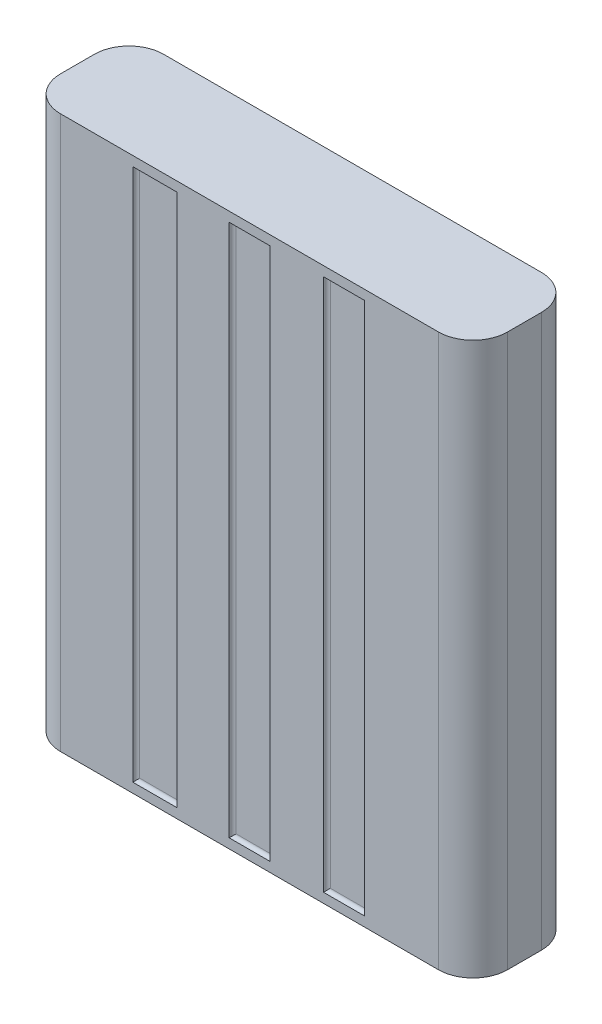
from build123d import *

# Parameters (mm, degrees)
SKETCH1_W           = 12.950156288
SKETCH1_H           = 2.985631362
BOSS_EXTRUDE1_DEPTH = 16
FILLET1_R           = 1
SKETCH2_W           = 10.950156288
SKETCH2_H           = 0.272417851
BOSS_EXTRUDE2_DEPTH = 0.1
FILLET2_R           = 0.1
CUT_EXTRUDE2_DEPTH  = 0.1
SKETCH6_W           = 1.186627285
SKETCH6_H           = 15.441785482
SKETCH6_W_2         = 1.175471446
SKETCH6_W_3         = 1.281551352
CUT_EXTRUDE3_DEPTH  = 0.1
SKETCH10_W          = 1.186627285
SKETCH10_H          = 15.441785482
SKETCH10_W_2        = 1.175471446
SKETCH10_W_3        = 1.281551352
CUT_EXTRUDE4_DEPTH  = 0.1
FILLET6_R           = 0.1
FILLET7_R           = 0.1


with BuildPart() as part:
    # Sketch1 → Boss-Extrude1 (new body)
    with BuildSketch(Plane(origin=(0, 0, 0), x_dir=(1, 0, 0), z_dir=(0, 1, 0))):
        Rectangle(SKETCH1_W, SKETCH1_H)
    extrude(amount=BOSS_EXTRUDE1_DEPTH)

    # Fillet1
    fillet1_edges = [part.edges().sort_by_distance(p)[0] for p in [
        (6.475078144, 8, 1.492815681),
        (-6.475078144, 8, 1.492815681),
        (-6.475078144, 8, -1.492815681),
        (6.475078144, 8, -1.492815681),
    ]]
    fillet(fillet1_edges, radius=FILLET1_R)

    # Sketch2 → Boss-Extrude2 (add)
    with BuildSketch(Plane(origin=(0, 0, -1.492815681), x_dir=(-1, 0, 0), z_dir=(0, 0, -1))):
        with Locations((0, 10.703223293)):
            Rectangle(SKETCH2_W, SKETCH2_H)
    extrude(amount=BOSS_EXTRUDE2_DEPTH)

    # Fillet2
    fillet2_edges = [part.edges().sort_by_distance(p)[0] for p in [
        (0, 10.839432218, -1.592815681),
        (-5.475078144, 10.703223292, -1.592815681),
        (0, 10.567014367, -1.592815681),
        (5.475078144, 10.703223292, -1.592815681),
    ]]
    fillet(fillet2_edges, radius=FILLET2_R - 0.0001)  # a hair under: the kernel refuses the full size

    # Sketch5 → Cut-Extrude2 (cut)
    with BuildSketch(Plane(origin=(0, 0, -1.592815681), x_dir=(-1, 0, 0), z_dir=(0, 0, -1))):
        Polygon((-5.375078144, 10.567014367), (5.475078144, 10.567014367), (5.475078144, 10.739432218), (5.475078144, 10.839432218), (-5.375078144, 10.839432218), (-5.475078144, 10.839432218), (-5.475078144, 10.567014367), align=None)
    extrude(amount=-CUT_EXTRUDE2_DEPTH, mode=Mode.SUBTRACT)

    # Sketch6 → Cut-Extrude3 (cut)
    with BuildSketch(Plane(origin=(0, 0, -1.492815681), x_dir=(-1, 0, 0), z_dir=(0, 0, -1))):
        with Locations((-2.737539072, 8)):
            Rectangle(SKETCH6_W, SKETCH6_H)
        with Locations((0, 8)):
            Rectangle(SKETCH6_W_2, SKETCH6_H)
        with Locations((2.737539072, 8)):
            Rectangle(SKETCH6_W_3, SKETCH6_H)
    extrude(amount=-CUT_EXTRUDE3_DEPTH, mode=Mode.SUBTRACT)

    # Sketch10 → Cut-Extrude4 (cut)
    with BuildSketch(Plane.XY.offset(1.492815681)):
        with Locations((2.737539072, 8)):
            Rectangle(SKETCH10_W, SKETCH10_H)
        with Locations((0, 8)):
            Rectangle(SKETCH10_W_2, SKETCH10_H)
        with Locations((-2.737539072, 8)):
            Rectangle(SKETCH10_W_3, SKETCH10_H)
    extrude(amount=-CUT_EXTRUDE4_DEPTH, mode=Mode.SUBTRACT)

    # Fillet6
    fillet6_edges = [part.edges().sort_by_distance(p)[0] for p in [
        (2.144225429, 8, 1.392815681),
        (2.737539072, 15.720892741, 1.392815681),
        (3.330852714, 8, 1.392815681),
        (2.737539072, 0.279107259, 1.392815681),
        (-0.587735723, 8, 1.392815681),
        (0, 15.720892741, 1.392815681),
        (0.587735723, 8, 1.392815681),
        (0, 0.279107259, 1.392815681),
        (-3.378314748, 8, 1.392815681),
        (-2.737539072, 15.720892741, 1.392815681),
        (-2.096763396, 8, 1.392815681),
        (-2.737539072, 0.279107259, 1.392815681),
    ]]
    fillet(fillet6_edges, radius=FILLET6_R - 0.0001)  # a hair under: the kernel refuses the full size

    # Fillet7
    fillet7_edges = [part.edges().sort_by_distance(p)[0] for p in [
        (-3.378314748, 8, -1.392815681),
        (-2.737539072, 0.279107259, -1.392815681),
        (-2.096763396, 8, -1.392815681),
        (-2.737539072, 15.720892741, -1.392815681),
        (-0.587735723, 8, -1.392815681),
        (0, 0.279107259, -1.392815681),
        (0.587735723, 8, -1.392815681),
        (0, 15.720892741, -1.392815681),
        (2.144225429, 8, -1.392815681),
        (2.737539072, 0.279107259, -1.392815681),
        (3.330852714, 8, -1.392815681),
        (2.737539072, 15.720892741, -1.392815681),
    ]]
    fillet(fillet7_edges, radius=FILLET7_R - 0.0001)  # a hair under: the kernel refuses the full size


solid = part.part
